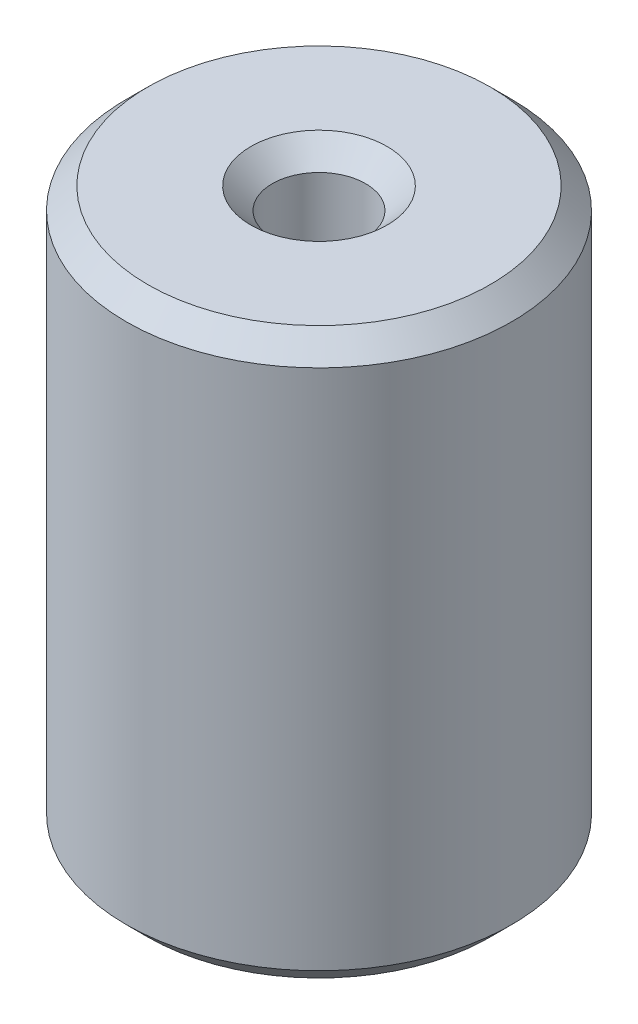
from build123d import *

# Parameters (mm, degrees)
SKETCH1_R           = 5
BOSS_EXTRUDE1_DEPTH = 14.660370559
SKETCH2_R           = 1.211300172
CUT_EXTRUDE1_DEPTH  = 17.276561828
CHAMFER1_SIZE       = 0.557128664


with BuildPart() as part:
    # Sketch1 → Boss-Extrude1 (new body)
    with BuildSketch(Plane(origin=(0, 0, 0), x_dir=(1, 0, 0), z_dir=(0, 1, 0))):
        Circle(SKETCH1_R)
    extrude(amount=BOSS_EXTRUDE1_DEPTH)

    # Sketch2 → Cut-Extrude1 (cut, through all)
    with BuildSketch(Plane(origin=(0, 0, 0), x_dir=(1, 0, 0), z_dir=(0, 1, 0))):
        Circle(SKETCH2_R)
    extrude(amount=CUT_EXTRUDE1_DEPTH, mode=Mode.SUBTRACT)

    # Chamfer1
    chamfer1_edges = [part.edges().sort_by_distance(p)[0] for p in [
        (-1.211300172, 14.660370559, 0),
        (-1.211300172, 0, 0),
        (-5, 0, 0),
        (-5, 14.660370559, 0),
    ]]
    chamfer(chamfer1_edges, length=CHAMFER1_SIZE)


solid = part.part
